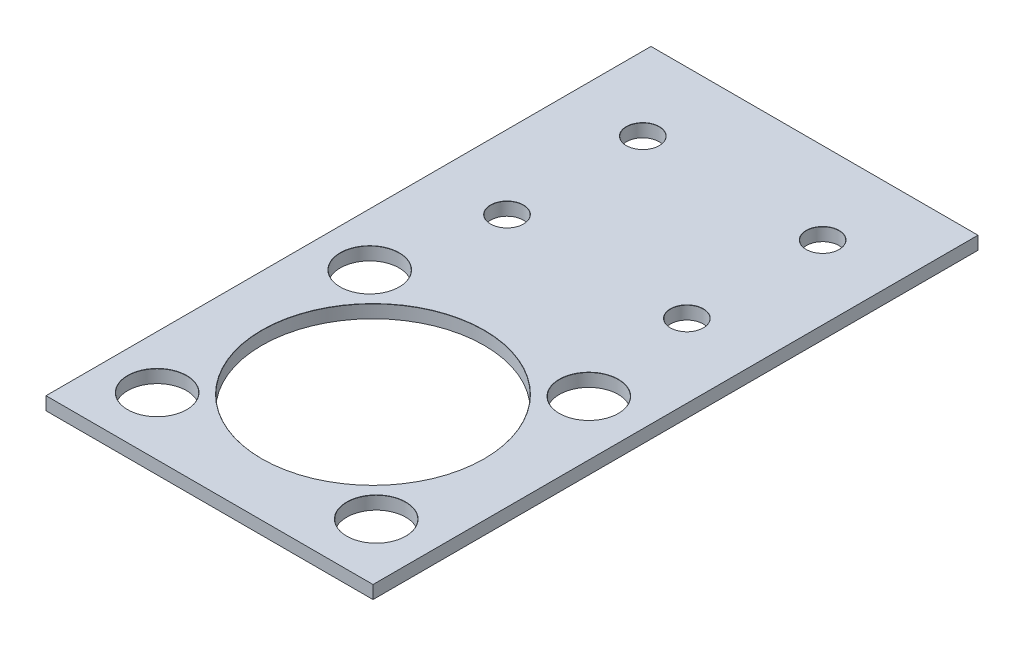
from build123d import *

# Parameters (mm, degrees)
SKETCH2_W                             = 50
SKETCH2_H                             = 92.5
BASE_FLANGE1_DEPTH                    = 2
TAP_DRILL_FOR_M6_TAP1_AT_2_COUNT      = 2
TAP_DRILL_FOR_M6_TAP1_AT_2_PITCH      = 34.456169259
TAP_DRILL_FOR_M6_TAP1_AT_3_COUNT      = 2
TAP_DRILL_FOR_M6_TAP1_AT_3_PITCH      = 27.5
TAP_DRILL_FOR_M6_TAP1_AT_4_COUNT      = 2
TAP_DRILL_FOR_M6_TAP1_AT_4_PITCH      = 20.76
TAP_DRILL_FOR_M10X1_0_TAP1_AT_2_COUNT = 2
TAP_DRILL_FOR_M10X1_0_TAP1_AT_2_PITCH = 32.5
TAP_DRILL_FOR_M10X1_0_TAP1_AT_3_COUNT = 2
TAP_DRILL_FOR_M10X1_0_TAP1_AT_3_PITCH = 46.67440412
TAP_DRILL_FOR_M10X1_0_TAP1_AT_4_COUNT = 2
TAP_DRILL_FOR_M10X1_0_TAP1_AT_4_PITCH = 33.5


# Sheet-metal steps are written as plain solids
with BuildPart() as part:
    # Sketch2 → Base-Flange1 (new body)
    with BuildSketch(Plane(origin=(0, 0, 0), x_dir=(1, 0, 0), z_dir=(0, 1, 0))):
        with Locations((-2.5, -1.25)):
            Rectangle(SKETCH2_W, SKETCH2_H)
    extrude(amount=-BASE_FLANGE1_DEPTH)

    # Sketch8 → Tap Drill for M6 Tap1 (revolve, cut)
    with BuildSketch(Plane(origin=(11.25, 0, -11.74), x_dir=(0, 0, 1), z_dir=(1, 0, 0))):
        Polygon((0, 0), (0, 2), (2.5, 2), (2.5, 0.025), (2.525, 0), align=None)
    tap_drill_for_m6_tap1 = revolve(axis=Axis((11.25, 6.35, -11.74), (0, -1, 0)), mode=Mode.SUBTRACT)

    # Tap Drill for M6 Tap1 at 2: Tap Drill for M6 Tap1 ×2
    with Locations(*[Vector(-0.7981154200092394, 0, -0.6025045861597035) * (i * TAP_DRILL_FOR_M6_TAP1_AT_2_PITCH) for i in range(1, TAP_DRILL_FOR_M6_TAP1_AT_2_COUNT)]):
        add(tap_drill_for_m6_tap1, mode=Mode.SUBTRACT)

    # Tap Drill for M6 Tap1 at 3: Tap Drill for M6 Tap1 ×2
    with Locations(*[(-i * TAP_DRILL_FOR_M6_TAP1_AT_3_PITCH, 0, 0) for i in range(1, TAP_DRILL_FOR_M6_TAP1_AT_3_COUNT)]):
        add(tap_drill_for_m6_tap1, mode=Mode.SUBTRACT)

    # Tap Drill for M6 Tap1 at 4: Tap Drill for M6 Tap1 ×2
    with Locations(*[(0, 0, -i * TAP_DRILL_FOR_M6_TAP1_AT_4_PITCH) for i in range(1, TAP_DRILL_FOR_M6_TAP1_AT_4_COUNT)]):
        add(tap_drill_for_m6_tap1, mode=Mode.SUBTRACT)

    # Sketch15 → Tap Drill for M10x1.0 Tap1 (revolve, cut)
    with BuildSketch(Plane(origin=(-19.417070164, 0, 6.087287234), x_dir=(0, 0, 1), z_dir=(1, 0, 0))):
        Polygon((0, 0), (0, 2), (4.5, 2), (4.5, 0.025), (4.525, 0), align=None)
    tap_drill_for_m10x1_0_tap1 = revolve(axis=Axis((-19.417070164, 6.35, 6.087287234), (0, -1, 0)), mode=Mode.SUBTRACT)

    # Tap Drill for M10x1.0 Tap1 at 2: Tap Drill for M10x1.0 Tap1 ×2
    with Locations(*[(0, 0, i * TAP_DRILL_FOR_M10X1_0_TAP1_AT_2_PITCH) for i in range(1, TAP_DRILL_FOR_M10X1_0_TAP1_AT_2_COUNT)]):
        add(tap_drill_for_m10x1_0_tap1, mode=Mode.SUBTRACT)

    # Tap Drill for M10x1.0 Tap1 at 3: Tap Drill for M10x1.0 Tap1 ×2
    with Locations(*[Vector(0.7177381400208425, 0, 0.6963131209157426) * (i * TAP_DRILL_FOR_M10X1_0_TAP1_AT_3_PITCH) for i in range(1, TAP_DRILL_FOR_M10X1_0_TAP1_AT_3_COUNT)]):
        add(tap_drill_for_m10x1_0_tap1, mode=Mode.SUBTRACT)

    # Tap Drill for M10x1.0 Tap1 at 4: Tap Drill for M10x1.0 Tap1 ×2
    with Locations(*[(i * TAP_DRILL_FOR_M10X1_0_TAP1_AT_4_PITCH, 0, 0) for i in range(1, TAP_DRILL_FOR_M10X1_0_TAP1_AT_4_COUNT)]):
        add(tap_drill_for_m10x1_0_tap1, mode=Mode.SUBTRACT)

    # Sketch18 → Tap Drill for M36x2.0 Tap1 (revolve, cut)
    with BuildSketch(Plane(origin=(-2.667070164, 0, 22.337287234), x_dir=(0, 0, 1), z_dir=(1, 0, 0))):
        Polygon((0, 0), (0, 2), (17, 2), (17, 0.025), (17.025, 0), align=None)
    revolve(axis=Axis((-2.667070164, 6.35, 22.337287234), (0, -1, 0)), mode=Mode.SUBTRACT)


solid = part.part
